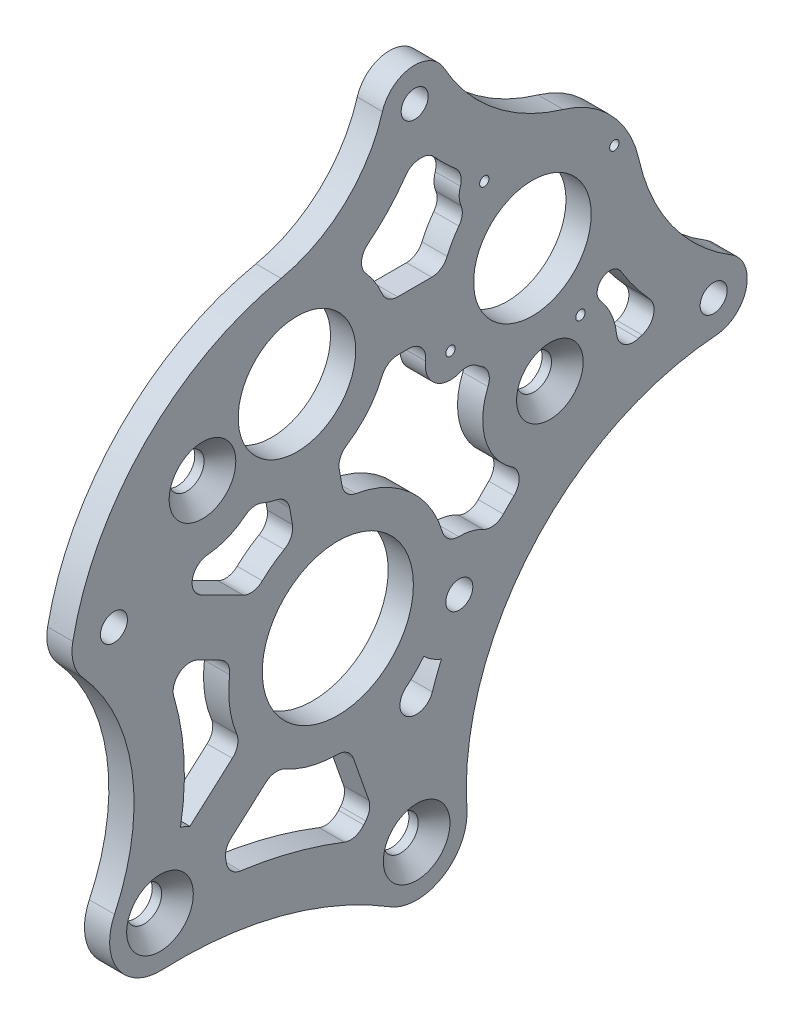
from build123d import *

# Parameters (mm, degrees)
SKETCH1_W                                      = 165.1
SKETCH1_H                                      = 165.1
BOSS_EXTRUDE2_DEPTH                            = 4.7625
SKETCH2_R                                      = 14.2875
SKETCH2_R_2                                    = 11.1125
CUT_EXTRUDE1_DEPTH                             = 234.535225194
CSK_FOR_M6_FLAT_HEAD_MACHINE_SCREW1_AT_2_COUNT = 2
CSK_FOR_M6_FLAT_HEAD_MACHINE_SCREW1_AT_2_PITCH = 67.750719553
CSK_FOR_M6_FLAT_HEAD_MACHINE_SCREW1_AT_3_COUNT = 2
CSK_FOR_M6_FLAT_HEAD_MACHINE_SCREW1_AT_3_PITCH = 89.21849584
CSK_FOR_M6_FLAT_HEAD_MACHINE_SCREW1_AT_4_COUNT = 2
CSK_FOR_M6_FLAT_HEAD_MACHINE_SCREW1_AT_4_PITCH = 67.750719553
F_10_CLEARANCE_HOLE2_D                         = 5.1054
SKETCH13_OUTSIDE_W                             = 213.808
SKETCH13_OUTSIDE_H                             = 213.808
CUT_EXTRUDE2_DEPTH                             = 234.535225194
F_2_56_TAPPED_HOLE1_D                          = 1.778
F_2_56_TAPPED_HOLE1_DEPTH                      = 5.588
F_2_56_TAPPED_HOLE1_TIP                        = 0.53416509
CUT_EXTRUDE3_DEPTH                             = 198.152856262
FILLET1_R                                      = 3.175
FILLET2_DEPTH                                  = 4.7625
FILLET3_DEPTH                                  = 4.7625
BOSS_EXTRUDE3_DEPTH                            = 4.7625


with BuildPart() as part:
    # Sketch1 → Boss-Extrude2 (new body)
    with BuildSketch(Plane(origin=(0, 0, 0), x_dir=(0, 0, -1), z_dir=(1, 0, 0))):
        with Locations((82.55, 82.55)):
            Rectangle(SKETCH1_W, SKETCH1_H)
    extrude(amount=BOSS_EXTRUDE2_DEPTH)

    # Sketch2 → Cut-Extrude1 (cut, through all)
    with BuildSketch(Plane(origin=(4.7625, 0, 0), x_dir=(0, 0, -1), z_dir=(1, 0, 0))):
        with Locations((58.531893488, 57.750253028)):
            Circle(SKETCH2_R)
        with Locations((50.8, 101.6)):
            Circle(SKETCH2_R_2)
        with Locations((95.3262, 101.6)):
            Circle(SKETCH2_R_2)
    extrude(amount=-CUT_EXTRUDE1_DEPTH, mode=Mode.SUBTRACT)

    # Sketch12 → CSK for M6 Flat Head Machine Screw1 (revolve, cut)
    with BuildSketch(Plane(origin=(4.7625, 78.179825516, -98.627187077), x_dir=(0, 0, -1), z_dir=(0, 1, 0))):
        Polygon((0, 0), (0, 4.7625), (3.3, 4.7625), (3.3, 3), (6.3, 0), align=None)
    csk_for_m6_flat_head_machine_screw1 = revolve(axis=Axis((11.1125, 78.179825516, -98.627187077), (-1, 0, 0)), mode=Mode.SUBTRACT)

    # CSK for M6 Flat Head Machine Screw1 at 2: CSK for M6 Flat Head Machine Screw1 ×2
    with Locations(*[Vector(0, -0.9282913433261896, 0.3718537103561809) * (i * CSK_FOR_M6_FLAT_HEAD_MACHINE_SCREW1_AT_2_PITCH) for i in range(1, CSK_FOR_M6_FLAT_HEAD_MACHINE_SCREW1_AT_2_COUNT)]):
        add(csk_for_m6_flat_head_machine_screw1, mode=Mode.SUBTRACT)

    # CSK for M6 Flat Head Machine Screw1 at 3: CSK for M6 Flat Head Machine Screw1 ×2
    with Locations(*[Vector(0, -0.5631851610705974, 0.8263307293994854) * (i * CSK_FOR_M6_FLAT_HEAD_MACHINE_SCREW1_AT_3_PITCH) for i in range(1, CSK_FOR_M6_FLAT_HEAD_MACHINE_SCREW1_AT_3_COUNT)]):
        add(csk_for_m6_flat_head_machine_screw1, mode=Mode.SUBTRACT)

    # CSK for M6 Flat Head Machine Screw1 at 4: CSK for M6 Flat Head Machine Screw1 ×2
    with Locations(*[Vector(0, 0.24479999033838462, 0.9695735994396335) * (i * CSK_FOR_M6_FLAT_HEAD_MACHINE_SCREW1_AT_4_PITCH) for i in range(1, CSK_FOR_M6_FLAT_HEAD_MACHINE_SCREW1_AT_4_COUNT)]):
        add(csk_for_m6_flat_head_machine_screw1, mode=Mode.SUBTRACT)

    # #10 Clearance Hole2 (through all)
    with Locations(Plane(origin=(4.7625, 0, 0), x_dir=(0, 0, -1), z_dir=(1, 0, 0))):
        with Locations((129.596912326, 76.301170448), (16.197602743, 79.098894937), (81.504835183, 51.797033225), (73.0631, 136.356006724)):
            Hole(F_10_CLEARANCE_HOLE2_D / 2)

    # Sketch13 outside → Cut-Extrude2 (cut, through all)
    with BuildSketch(Plane(origin=(4.7625, 0, 0), x_dir=(0, 0, -1), z_dir=(1, 0, 0))):
        with Locations((82.55, 82.55)):
            Rectangle(SKETCH13_OUTSIDE_W, SKETCH13_OUTSIDE_H)
        with BuildLine():
            ThreePointArc((8.414203333, 80.655365266), (8.540090568, 77.009298433), (10.283636457, 73.804661374))
            ThreePointArc((10.283636457, 73.804661374), (19.607363328, 53.824485314), (16.301881523, 32.025102107))
            ThreePointArc((16.301881523, 32.025102107), (16.958697728, 22.67872583), (25.302620293, 18.416670776))
            ThreePointArc((25.302620293, 18.416670776), (47.712182377, 16.021433139), (68.440956559, 7.175894318))
            ThreePointArc((68.440956559, 7.175894318), (78.353390423, 7.131221624), (82.937806074, 15.919934494))
            ThreePointArc((82.937806074, 15.919934494), (95.330096734, 52.671317138), (130.044552634, 69.966968198))
            ThreePointArc((130.044552634, 69.966968198), (135.768368696, 74.805969366), (132.894005278, 81.728110476))
            ThreePointArc((132.894005278, 81.728110476), (121.696692342, 92.111887476), (115.476327536, 106.058561037))
            ThreePointArc((115.476327536, 106.058561037), (110.411058442, 115.683801051), (101.155732897, 121.397044033))
            ThreePointArc((101.155732897, 121.397044033), (88.109331485, 128.20052077), (78.613792496, 139.44021048))
            ThreePointArc((78.613792496, 139.44021048), (72.358083923, 142.666747753), (66.968631694, 138.139249856))
            ThreePointArc((66.968631694, 138.139249856), (59.837579309, 126.625314573), (47.803158832, 120.412799978))
            ThreePointArc((47.803158832, 120.412799978), (22.140089856, 106.447355848), (8.414203333, 80.655365266))
        make_face(mode=Mode.SUBTRACT)
    extrude(amount=-CUT_EXTRUDE2_DEPTH, mode=Mode.SUBTRACT)

    # #2-56 Tapped Hole1
    with Locations(Plane(origin=(4.7625, 0, 0), x_dir=(0, 0, -1), z_dir=(1, 0, 0))):
        with Locations((86.238946953, 117.091992514), (110.818192514, 110.687253047), (104.413453047, 86.108007486), (79.834207486, 92.512746953), (95.3262, 101.6)):
            Hole(F_2_56_TAPPED_HOLE1_D / 2, depth=F_2_56_TAPPED_HOLE1_DEPTH)
            with Locations((0, 0, -(F_2_56_TAPPED_HOLE1_DEPTH + F_2_56_TAPPED_HOLE1_TIP / 2))):  # 118° drill point
                Cone(0, F_2_56_TAPPED_HOLE1_D / 2, F_2_56_TAPPED_HOLE1_TIP, mode=Mode.SUBTRACT)

    # Sketch14 → Cut-Extrude3 (cut, through all)
    with BuildSketch(Plane(origin=(4.7625, 0, 0), x_dir=(0, 0, -1), z_dir=(1, 0, 0))):
        with BuildLine():
            Line((50.354810733, 76.698649368), (49.027232901, 84.227717391))
            ThreePointArc((49.027232901, 84.227717391), (45.608911398, 84.926922738), (42.397829197, 86.291752809))
            ThreePointArc((42.397829197, 86.291752809), (31.080549713, 82.201748798), (21.430811693, 89.391429172))
            ThreePointArc((21.430811693, 89.391429172), (20.98380717, 88.484366574), (20.559157887, 87.566625549))
            ThreePointArc((20.559157887, 87.566625549), (24.186541818, 84.285654759), (25.707389023, 79.637030522))
            Line((25.707389023, 79.637030522), (42.746660927, 71.044343415))
            ThreePointArc((42.746660927, 71.044343415), (46.221697195, 74.314234236), (50.354810733, 76.698649368))
        make_face()
        with BuildLine():
            Line((77.839735792, 96.8375), (67.600520825, 96.8375))
            ThreePointArc((67.600520825, 96.8375), (64.177051088, 90.375321366), (58.407526749, 85.881716283))
            Line((58.407526749, 85.881716283), (59.735104581, 78.35264826))
            ThreePointArc((59.735104581, 78.35264826), (72.392363589, 73.040569403), (78.917640196, 60.963932761))
            ThreePointArc((78.917640196, 60.963932761), (83.74928199, 61.053819035), (88.003201541, 58.761001898))
            ThreePointArc((88.003201541, 58.761001898), (91.519708332, 62.492808375), (95.340426815, 65.912502785))
            ThreePointArc((95.340426815, 65.912502785), (86.664213743, 73.916344659), (88.322793086, 85.603400429))
            ThreePointArc((88.322793086, 85.603400429), (85.5765047, 87.112683209), (83.144188528, 89.088505176))
            ThreePointArc((83.144188528, 89.088505176), (75.904274737, 89.822573197), (77.839735792, 96.8375))
        make_face()
        with BuildLine():
            Line((78.525679175, 106.3625), (67.600520825, 106.3625))
            ThreePointArc((67.600520825, 106.3625), (65.144253709, 111.558980459), (61.133950082, 115.676518815))
            ThreePointArc((61.133950082, 115.676518815), (67.342643222, 120.632826568), (72.270619035, 126.864031222))
            ThreePointArc((72.270619035, 126.864031222), (73.935626026, 126.871054255), (75.573971291, 127.167908424))
            ThreePointArc((75.573971291, 127.167908424), (78.973428867, 123.553583421), (82.730484532, 120.312566638))
            ThreePointArc((82.730484532, 120.312566638), (81.476842947, 117.030578522), (82.814705176, 113.782011472))
            ThreePointArc((82.814705176, 113.782011472), (80.207970838, 110.339453831), (78.525679175, 106.3625))
        make_face()
        with BuildLine():
            Line((73.958149562, 28.175468234), (69.675165411, 40.379763768))
            ThreePointArc((69.675165411, 40.379763768), (72.429935065, 42.49407898), (74.791196527, 45.040356453))
            ThreePointArc((74.791196527, 45.040356453), (76.338437809, 43.794910808), (78.110333426, 42.897427457))
            ThreePointArc((78.110333426, 42.897427457), (75.565729822, 35.668586957), (73.958149562, 28.175468234))
        make_face()
        with BuildLine():
            Line((36.871967224, 32.180487756), (46.666472674, 40.864809736))
            ThreePointArc((46.666472674, 40.864809736), (53.347229418, 37.774626261), (60.687553945, 37.225645011))
            Line((60.687553945, 37.225645011), (65.041429773, 24.819344765))
            ThreePointArc((65.041429773, 24.819344765), (63.426305183, 23.106590004), (62.155053557, 21.125157286))
            ThreePointArc((62.155053557, 21.125157286), (50.113959677, 25.238650225), (37.596620588, 27.52447351))
            ThreePointArc((37.596620588, 27.52447351), (37.452124061, 29.886383312), (36.871967224, 32.180487756))
        make_face()
        with BuildLine():
            Line((30.55281061, 39.307470616), (40.34731606, 47.991792596))
            ThreePointArc((40.34731606, 47.991792596), (38.066295005, 55.092117411), (38.457806874, 62.539559119))
            Line((38.457806874, 62.539559119), (24.566420744, 69.544807652))
            ThreePointArc((24.566420744, 69.544807652), (29.043428881, 55.124129751), (28.781111695, 40.026754394))
            ThreePointArc((28.781111695, 40.026754394), (29.680517518, 39.700503774), (30.55281061, 39.307470616))
        make_face()
        with BuildLine():
            ThreePointArc((120.513072528, 79.166389381), (120.364783439, 78.644975306), (120.246397417, 78.115969596))
            ThreePointArc((120.246397417, 78.115969596), (115.551254029, 76.846985419), (110.97359689, 75.203894614))
            ThreePointArc((110.97359689, 75.203894614), (110.625724658, 82.342168115), (106.478256237, 88.162345892))
            ThreePointArc((106.478256237, 88.162345892), (108.567090448, 90.215021898), (110.283511572, 92.58791163))
            ThreePointArc((110.283511572, 92.58791163), (114.799078924, 85.420444695), (120.513072528, 79.166389381))
        make_face()
    extrude(amount=-CUT_EXTRUDE3_DEPTH, mode=Mode.SUBTRACT)

    # Fillet1
    # the kernel refuses this fillet: 3.175 mm, written as the material it adds along each edge
    with BuildSketch(Plane(origin=(4.7625, 75.203894614, -110.97359689), x_dir=(0, 0.9977857755033891, -0.06650974517392466), z_dir=(-1, 0, 0))) as fillet1_piece_1:
        with BuildLine():
            CenterArc((4.833416143, 3.129250124), FILLET1_R, 158.579073901, 101.682615917)
            ThreePointArc((1.877737237, 4.288813492), (0.980491477, 2.126183339), (0, 0))
            ThreePointArc((0, 0), (2.148184952, 0.182999504), (4.296369905, 0))
        make_face()
    extrude(amount=4.7625)
    with BuildSketch(Plane(origin=(4.7625, 127.167908424, -75.573971291), x_dir=(0, -0.7512130680378686, -0.6600597900259738), z_dir=(-1, 0, 0))) as fillet1_piece_2:
        with BuildLine():
            CenterArc((1.795351799, 3.174471752), FILLET1_R, 215.378394206, 53.576426358)
            ThreePointArc((-0.793372323, 1.336230087), (-0.369389804, 0.684321964), (0, 0))
            ThreePointArc((0, 0), (0.868718612, 0.007923725), (1.737437225, 0))
        make_face()
    extrude(amount=4.7625)
    with BuildSketch(Plane(origin=(4.7625, 126.864031222, -72.270619035), x_dir=(0, -0.8371817663172271, 0.5469247572984494), z_dir=(-1, 0, 0))) as fillet1_piece_3:
        with BuildLine():
            CenterArc((1.717992406, -3.174121234), FILLET1_R, 91.348069791, 51.317812547)
            ThreePointArc((-0.806489764, -1.24860448), (-0.37885142, -0.640058293), (0, 0))
            ThreePointArc((0, 0), (0.821648542, -0.009666425), (1.643297084, 0))
        make_face()
    extrude(amount=4.7625)
    with BuildSketch(Plane(origin=(4.7625, 115.676518815, -61.133950082), x_dir=(0, 0.5759363667131275, -0.8174945268913314), z_dir=(-1, 0, 0))) as fillet1_piece_4:
        with BuildLine():
            CenterArc((3.944049058, 3.170365827), FILLET1_R, 173.362553197, 93.541419777)
            ThreePointArc((0.790329705, 3.537352534), (0.487191201, 1.748115366), (0, 0))
            ThreePointArc((0, 0), (1.886284332, 0.050975907), (3.772568664, 0))
        make_face()
    extrude(amount=4.7625)
    with BuildSketch(Plane(origin=(4.7625, 106.3625, -67.600520825), x_dir=(0, 0.9442428848729634, 0.32924971430023064), z_dir=(-1, 0, 0)), Plane(origin=(4.7625, 85.881716283, -58.407526749), x_dir=(0, 0.4882137275530758, -0.8727241008639163), z_dir=(-1, 0, 0))) as fillet1_piece_5:
        with BuildLine():
            CenterArc((2.257330784, 3.169422548), FILLET1_R, 199.22324254, 67.380135052)
            Line((-0.740640376, 2.124054705), (0, 0))
            ThreePointArc((0, 0), (1.034609943, 0.030675984), (2.069219885, 0))
        make_face()
    extrude(amount=4.7625)
    with BuildSketch(Plane(origin=(4.7625, 96.8375, -67.600520825), x_dir=(0, 0, -1), z_dir=(-1, 0, 0)), Plane(origin=(4.7625, 84.227717391, -49.027232901), x_dir=(0, -0.9848077530122078, -0.17364817766693133), z_dir=(-1, 0, 0)), Plane(origin=(4.7625, 106.3625, -78.525679175), x_dir=(0, 0, 1), z_dir=(-1, 0, 0))) as fillet1_piece_6:
        with BuildLine():
            CenterArc((2.249479175, 3.175), FILLET1_R, 202.619864948, 67.380135052)
            ThreePointArc((-0.681290056, 1.953846154), (-0.311679448, 0.987023136), (0, 0))
            Line((0, 0), (2.249479175, 0))
        make_face()
    extrude(amount=4.7625)
    with BuildSketch(Plane(origin=(4.7625, 78.35264826, -59.735104581), x_dir=(0, 0.984807753012208, 0.1736481776669306), z_dir=(-1, 0, 0)), Plane(origin=(4.7625, 71.044343415, -42.746660927), x_dir=(0, 0.45027339137825895, 0.8928907396858371), z_dir=(-1, 0, 0)), Plane(origin=(4.7625, 47.991792596, -40.34731606), x_dir=(0, -0.6634285159385771, 0.7482396703193016), z_dir=(-1, 0, 0)), Plane(origin=(4.7625, 37.225645011, -60.687553945), x_dir=(0, -0.9435812562796371, -0.3311410768807486), z_dir=(-1, 0, 0))) as fillet1_piece_7:
        with BuildLine():
            CenterArc((2.370177161, 3.175), FILLET1_R, 199.471220634, 70.528779366)
            ThreePointArc((-0.623241546, 2.116666667), (-0.283311881, 1.06666874), (0, 0))
            Line((0, 0), (2.370177161, 0))
        make_face()
    extrude(amount=4.7625)
    with BuildSketch(Plane(origin=(4.7625, 85.603400429, -88.322793086), x_dir=(0, -0.8719162001506542, 0.4896551234438832), z_dir=(-1, 0, 0))) as fillet1_piece_8:
        with BuildLine():
            CenterArc((3.211055815, 3.154889886), FILLET1_R, 183.968990644, 79.578887947)
            ThreePointArc((0.043670552, 2.935127287), (0.083619072, 1.466644388), (0, 0))
            ThreePointArc((0, 0), (1.427135918, 0.080440456), (2.854271835, 0))
        make_face()
    extrude(amount=4.7625)
    with BuildSketch(Plane(origin=(4.7625, 65.912502785, -95.340426815), x_dir=(0, -0.664160498970229, 0.7475900157222649), z_dir=(-1, 0, 0))) as fillet1_piece_9:
        with BuildLine():
            CenterArc((4.805067417, 3.172608559), FILLET1_R, 166.093445249, 101.682615917)
            ThreePointArc((1.723129865, 3.935685179), (1.029201438, 1.894447626), (0, 0))
            ThreePointArc((0, 0), (2.34093028, 0.045437374), (4.68186056, 0))
        make_face()
    extrude(amount=4.7625)
    with BuildSketch(Plane(origin=(4.7625, 58.761001898, -88.003201541), x_dir=(0, 0.5833327450870434, 0.8122332845366623), z_dir=(-1, 0, 0))) as fillet1_piece_10:
        with BuildLine():
            CenterArc((2.837049808, 3.149025678), FILLET1_R, 187.777182, 74.888927949)
            ThreePointArc((-0.308745941, 2.719381512), (-0.138949218, 1.361441897), (0, 0))
            ThreePointArc((0, 0), (1.215878489, 0.077922965), (2.431756978, 0))
        make_face()
    extrude(amount=4.7625)
    with BuildSketch(Plane(origin=(4.7625, 60.963932761, -78.917640196), x_dir=(0, 0.9755042908155, 0.21998040503769514), z_dir=(-1, 0, 0))) as fillet1_piece_11:
        with BuildLine():
            CenterArc((2.906629274, 3.168204608), FILLET1_R, 192.094312498, 74.156384819)
            ThreePointArc((-0.197898552, 2.502973841), (-0.016115141, 1.258036232), (0, 0))
            ThreePointArc((0, 0), (1.349506449, 0.044170046), (2.699012898, 0))
        make_face()
    extrude(amount=4.7625)
    with BuildSketch(Plane(origin=(4.7625, 86.291752809, -42.397829197), x_dir=(0, -0.4301246301450633, -0.9027695179516045), z_dir=(-1, 0, 0))) as fillet1_piece_12:
        with BuildLine():
            CenterArc((2.183497143, 3.169781736), FILLET1_R, 205.164697136, 61.549902477)
            ThreePointArc((-0.690161146, 1.819702837), (-0.31017217, 0.923091175), (0, 0))
            ThreePointArc((0, 0), (1.000769524, 0.028700454), (2.001539048, 0))
        make_face()
    extrude(amount=4.7625)
    with BuildSketch(Plane(origin=(4.7625, 79.637030522, -25.707389023), x_dir=(0, 0.9912619501384449, 0.13190809758209326), z_dir=(-1, 0, 0))) as fillet1_piece_13:
        with BuildLine():
            CenterArc((1.682297137, 3.165891245), FILLET1_R, 214.341093727, 51.317812547)
            Line((-0.939281025, 1.374815329), (0, 0))
            ThreePointArc((0, 0), (0.720984487, 0.027326265), (1.441968975, 0))
        make_face()
    extrude(amount=4.7625)
    with BuildSketch(Plane(origin=(4.7625, 76.698649368, -50.354810733), x_dir=(0, 0.9848077530122074, 0.17364817766693455), z_dir=(-1, 0, 0))) as fillet1_piece_14:
        with BuildLine():
            CenterArc((2.370177161, -3.175), FILLET1_R, 90, 70.528779366)
            ThreePointArc((-0.623241546, -2.116666667), (-0.283311881, -1.06666874), (0, 0))
            Line((0, 0), (2.370177161, 0))
        make_face()
    extrude(amount=4.7625)
    with BuildSketch(Plane(origin=(4.7625, 62.539559119, -38.457806874), x_dir=(0, -0.9837147237115613, 0.1797368697654618), z_dir=(-1, 0, 0)), Plane(origin=(4.7625, 40.379763768, -69.675165411), x_dir=(0, 0.5841765887626399, -0.8116265847923203), z_dir=(-1, 0, 0)), Plane(origin=(4.7625, 40.864809736, -46.666472674), x_dir=(0, -0.5303829032756066, -0.8477582060428188), z_dir=(-1, 0, 0))) as fillet1_piece_15:
        with BuildLine():
            CenterArc((2.376246766, 3.170459916), FILLET1_R, 196.406792216, 70.528779366)
            Line((-0.669468812, 2.273664725), (0, 0))
            ThreePointArc((0, 0), (1.103257427, 0.029510547), (2.206514854, 0))
        make_face()
    extrude(amount=4.7625)
    with BuildSketch(Plane(origin=(4.7625, 69.544807652, -24.566420744), x_dir=(0, -0.45027339137825784, -0.8928907396858375), z_dir=(-1, 0, 0))) as fillet1_piece_16:
        with BuildLine():
            CenterArc((8.315138503, 3.175), FILLET1_R, 136.567575404, 133.432424596)
            ThreePointArc((6.00949884, 5.357807995), (3.118170846, 2.551686686), (0, 0))
            Line((0, 0), (8.315138503, 0))
        make_face()
    extrude(amount=4.7625)
    with BuildSketch(Plane(origin=(4.7625, 28.175468234, -73.958149562), x_dir=(0, 0.9725448614380224, -0.23271547539967724), z_dir=(-1, 0, 0))) as fillet1_piece_17:
        with BuildLine():
            CenterArc((10.770770217, -3.162965878), FILLET1_R, 94.990111398, 142.214843724)
            Line((9.051077462, -5.831913579), (0, 0))
            ThreePointArc((0, 0), (5.247298311, -0.228648318), (10.494596622, 0))
        make_face()
    extrude(amount=4.7625)
    with BuildSketch(Plane(origin=(4.7625, 32.180487756, -36.871967224), x_dir=(0, 0.6634285159385782, -0.7482396703193006), z_dir=(-1, 0, 0))) as fillet1_piece_18:
        with BuildLine():
            CenterArc((1.974938187, 3.175), FILLET1_R, 210, 60)
            ThreePointArc((-0.77469247, 1.5875), (-0.359712181, 0.807235287), (0, 0))
            Line((0, 0), (1.974938187, 0))
        make_face()
    extrude(amount=4.7625)
    with BuildSketch(Plane(origin=(4.7625, 27.52447351, -37.596620588), x_dir=(0, -0.12110339381979622, -0.9926398984552894), z_dir=(-1, 0, 0))) as fillet1_piece_19:
        with BuildLine():
            CenterArc((2.630339994, -3.174639795), FILLET1_R, 90.863067029, 73.398450401)
            ThreePointArc((-0.425628561, -2.313430651), (-0.159138047, -1.166590763), (0, 0))
            ThreePointArc((0, 0), (1.291257815, -0.009725525), (2.58251563, 0))
        make_face()
    extrude(amount=4.7625)
    with BuildSketch(Plane(origin=(4.7625, 24.819344765, -65.041429773), x_dir=(0, -0.711415548519185, 0.7027715968400738), z_dir=(-1, 0, 0))) as fillet1_piece_20:
        with BuildLine():
            CenterArc((1.987243217, 3.167312779), FILLET1_R, 206.012156419, 60)
            Line((-0.866132513, 1.774878957), (0, 0))
            ThreePointArc((0, 0), (0.883219207, 0.030748884), (1.766438415, 0))
        make_face()
    extrude(amount=4.7625)
    with BuildSketch(Plane(origin=(4.7625, 21.125157286, -62.155053557), x_dir=(0, 0.37871914469337303, 0.9255116473836081), z_dir=(-1, 0, 0))) as fillet1_piece_21:
        with BuildLine():
            CenterArc((2.630339994, 3.174639795), FILLET1_R, 195.73848257, 73.398450401)
            ThreePointArc((-0.425628561, 2.313430651), (-0.159138047, 1.166590763), (0, 0))
            ThreePointArc((0, 0), (1.291257815, 0.009725525), (2.58251563, 0))
        make_face()
    extrude(amount=4.7625)
    with BuildSketch(Plane(origin=(4.7625, 89.088505176, -83.144188528), x_dir=(0, -0.6524985398583254, -0.7577899811179568), z_dir=(-1, 0, 0)), Plane(origin=(4.7625, 113.782011472, -82.814705176), x_dir=(0, -0.7577899811179568, 0.6524985398583254), z_dir=(-1, 0, 0))) as fillet1_piece_22:
        with BuildLine():
            CenterArc((2.32947085, 3.169060023), FILLET1_R, 207.004931781, 59.489762594)
            ThreePointArc((-0.499350783, 1.727396688), (-0.167411575, 0.887478927), (0, 0))
            ThreePointArc((0, 0), (1.067674139, 0.032669875), (2.135348279, 0))
        make_face()
    extrude(amount=4.7625)
    with BuildSketch(Plane(origin=(4.7625, 96.8375, -77.839735792), x_dir=(0, 0, 1), z_dir=(-1, 0, 0))) as fillet1_piece_23:
        with BuildLine():
            CenterArc((5.859315557, -3.175), FILLET1_R, 90, 98.328638143)
            ThreePointArc((2.717800657, -3.634901219), (1.819742595, -1.472880747), (0, 0))
            Line((0, 0), (5.859315557, 0))
        make_face()
    extrude(amount=4.7625)
    with BuildSketch(Plane(origin=(4.7625, 120.312566638, -82.730484532), x_dir=(0, -0.8642697590821007, 0.503028611051268), z_dir=(-1, 0, 0))) as fillet1_piece_24:
        with BuildLine():
            CenterArc((2.716234249, 3.1015326), FILLET1_R, 190.65994531, 66.990419845)
            ThreePointArc((-0.403972723, 2.514222246), (-0.185179183, 1.259811617), (0, 0))
            ThreePointArc((0, 0), (1.018587843, 0.1102011), (2.037175686, 0))
        make_face()
    extrude(amount=4.7625)

    # Fillet2: read off the stored shape, not the designer's step
    # Fillet2 outline → Fillet2 (add)
    with BuildSketch(Plane.YZ):
        with BuildLine():
            ThreePointArc((88.162345892, -106.478256237), (87.401750937, -107.359087874), (86.563718507, -108.166596824))
            add(Edge.make_bspline(
                [(86.563718507, -108.166596824), (86.975644037, -107.804568181), (87.556984946, -107.498226168), (88.306068794, -107.371070994), (89.124793434, -107.579829939), (89.801819021, -108.20027596)],
                knots=[0, 0, 0, 0, 0, 0, 0.455387101, 0.455387101, 0.455387101, 0.455387101, 0.455387101, 0.455387101], degree=5, weights=[1, 0.80221541, 0.649465096, 0.541749057, 0.479067294, 0.461419806]))
            ThreePointArc((89.801819021, -108.20027596), (88.952740174, -107.367201832), (88.162345892, -106.478256237))
        make_face()
        with BuildLine():
            ThreePointArc((92.58791163, -110.283511572), (91.142859126, -109.31144619), (89.801819021, -108.20027596))
            add(Edge.make_bspline(
                [(89.801819021, -108.20027596), (90.682757822, -109.007594008), (90.927897375, -110.099892426), (90.596817761, -111.057628918), (90.017209232, -111.695356555), (89.429406013, -112.05509219)],
                knots=[0.455387101, 0.455387101, 0.455387101, 0.455387101, 0.455387101, 0.455387101, 1, 1, 1, 1, 1, 1], degree=5, weights=[0.461419806, 0.440314576, 0.483619981, 0.59133602, 0.763462693, 1]))
            ThreePointArc((89.429406013, -112.05509219), (90.991813806, -111.139269335), (92.58791163, -110.283511572))
        make_face()
    extrude(amount=FILLET2_DEPTH)

    # Fillet3: read off the stored shape, not the designer's step
    # Fillet3 outline → Fillet3 (add)
    with BuildSketch(Plane.YZ):
        with BuildLine():
            ThreePointArc((79.166389381, -120.513072528), (79.354586692, -120.308755762), (79.543972519, -120.105540169))
            add(Edge.make_bspline(
                [(79.543972519, -120.105540169), (79.323638058, -120.340586282), (79.000458175, -120.455281727), (78.651129583, -120.366348038)],
                knots=[0, 0, 0, 0, 0.495518942, 0.495518942, 0.495518942, 0.495518942], degree=3, weights=[1, 0.826025641, 0.738258873, 0.736699695]))
            ThreePointArc((78.651129583, -120.366348038), (78.909791269, -120.436086904), (79.166389381, -120.513072528))
        make_face()
        with BuildLine():
            ThreePointArc((78.115969596, -120.246397417), (78.384413095, -120.302520196), (78.651129583, -120.366348039))
            add(Edge.make_bspline(
                [(78.651129583, -120.366348039), (78.293960621, -120.275418312), (78.063012219, -120.01168021), (77.986959056, -119.691332511)],
                knots=[0.495518942, 0.495518942, 0.495518942, 0.495518942, 1, 1, 1, 1], degree=3, weights=[0.736699695, 0.735112317, 0.822879085, 1]))
            ThreePointArc((77.986959056, -119.691332511), (78.052119757, -119.968712626), (78.115969596, -120.246397417))
        make_face()
    extrude(amount=FILLET3_DEPTH)

    # Sketch15 → Boss-Extrude3 (add)
    with BuildSketch(Plane(origin=(4.7625, 0, 0), x_dir=(0, 0, -1), z_dir=(1, 0, 0))):
        with BuildLine():
            Line((27.19408992, 78.887306256), (32.718405342, 76.101464574))
            ThreePointArc((32.718405342, 76.101464574), (31.033433434, 79.552797243), (33.905994298, 82.102154339))
            ThreePointArc((33.905994298, 82.102154339), (26.530792189, 83.799835045), (21.430811693, 89.391429172))
            ThreePointArc((21.430811693, 89.391429172), (20.98380717, 88.484366574), (20.559157887, 87.566625549))
            ThreePointArc((20.559157887, 87.566625549), (23.771016229, 84.875488498), (25.517181639, 81.0663995))
            ThreePointArc((25.517181639, 81.0663995), (26.107507795, 79.785907459), (27.19408992, 78.887306256))
        make_face()
        with BuildLine():
            ThreePointArc((116.076052311, 77.009174407), (118.214089619, 79.206249631), (117.497648893, 82.187030696))
            ThreePointArc((117.497648893, 82.187030696), (118.775826608, 80.840076537), (120.105540169, 79.543972519))
            ThreePointArc((120.105540169, 79.543972519), (120.36387932, 78.641645377), (119.691332511, 77.986959056))
            ThreePointArc((119.691332511, 77.986959056), (117.876102576, 77.526129536), (116.076052311, 77.009174407))
        make_face()
    extrude(amount=-BOSS_EXTRUDE3_DEPTH)


solid = part.part
